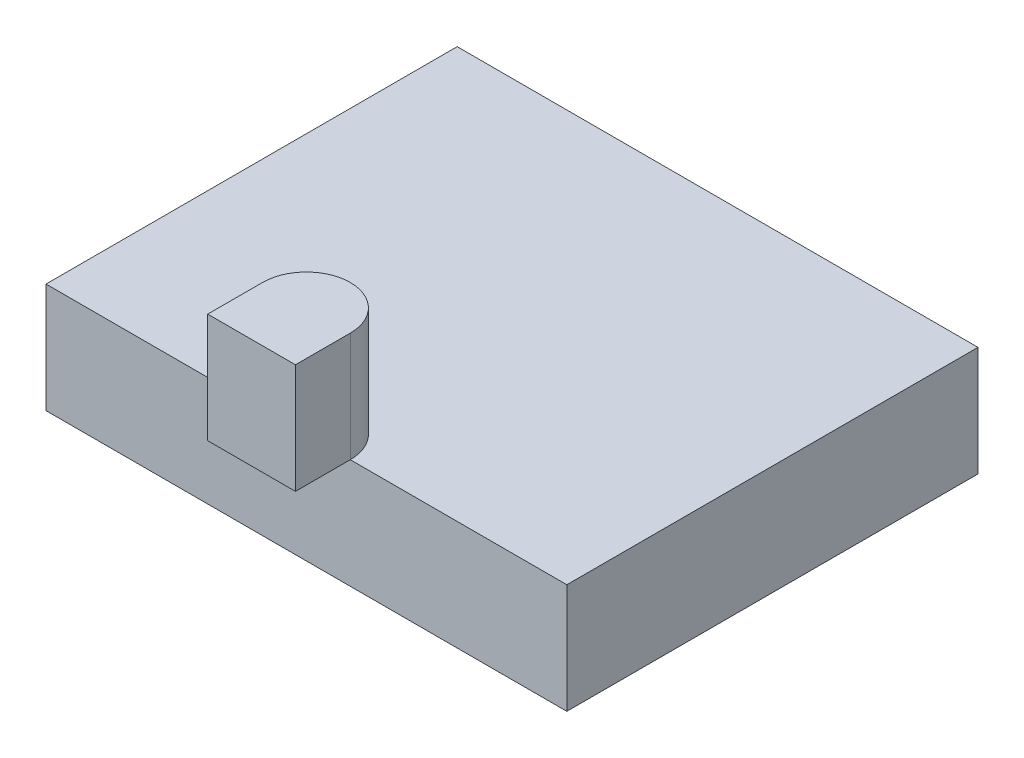
from build123d import *

# Parameters (mm, degrees)
SKETCH1_W           = 95
SKETCH1_H           = 75
BOSS_EXTRUDE1_DEPTH = 10
SKETCH2_W           = 8
SKETCH2_H           = 20
REVOLVE1_ANGLE      = 180
SKETCH3_W           = 16
SKETCH3_H           = 20
BOSS_EXTRUDE2_DEPTH = 10


with BuildPart() as part:
    # Sketch1 → Boss-Extrude1 (new, symmetric)
    with BuildSketch(Plane(origin=(0, 0, 0), x_dir=(1, 0, 0), z_dir=(0, 1, 0))):
        Rectangle(SKETCH1_W, SKETCH1_H)
    extrude(amount=BOSS_EXTRUDE1_DEPTH, both=True)

    # Sketch2 → Revolve1 (revolve)
    with BuildSketch(Plane.XY.offset(37.5)):
        with Locations((-4, 20)):
            Rectangle(SKETCH2_W, SKETCH2_H)
    revolve(axis=Axis((0, 10, 37.5), (0, -1, 0)), revolution_arc=REVOLVE1_ANGLE)

    # Sketch3 → Boss-Extrude2 (add)
    with BuildSketch(Plane.XY.offset(37.5)):
        with Locations((0, 20)):
            Rectangle(SKETCH3_W, SKETCH3_H)
    extrude(amount=BOSS_EXTRUDE2_DEPTH)


solid = part.part
